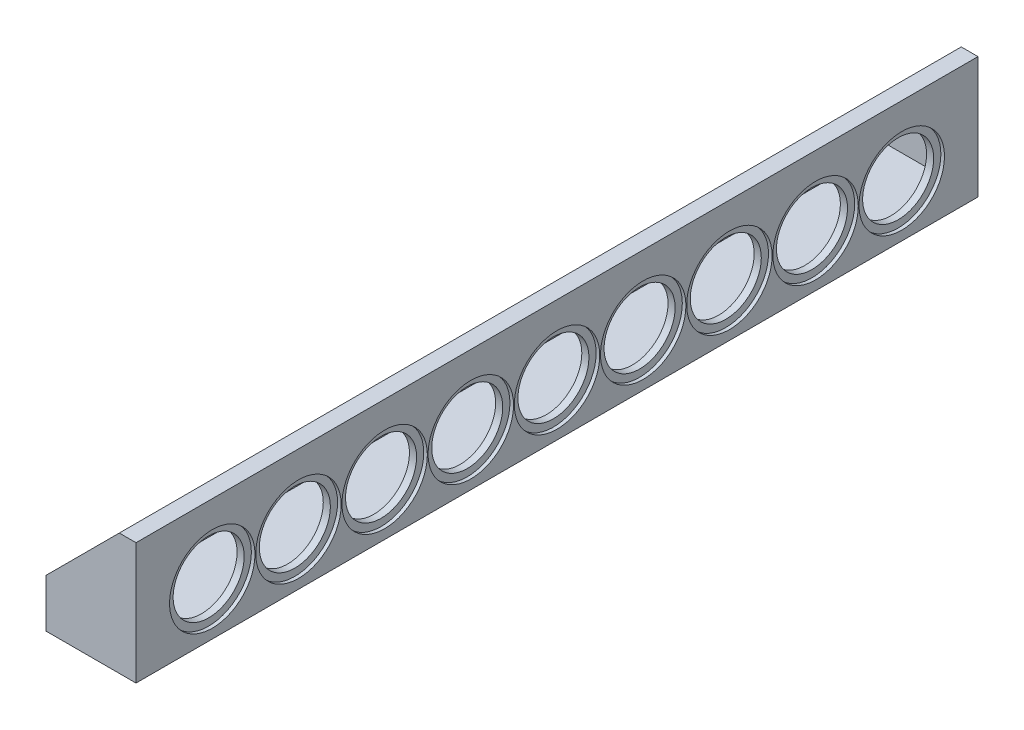
from build123d import *

# Parameters (mm, degrees)
BOSS_EXTRUDE1_DEPTH = 889
CHAMFER1_SIZE       = 51
CHAMFER1_SIZE2      = 72.124891681
CHAMFER2_SIZE       = 25
CHAMFER2_SIZE2      = 17.67766953
SKETCH4_R           = 45.1
CUT_EXTRUDE2_DEPTH  = 3.8
SKETCH5_R           = 37.5
CUT_EXTRUDE3_DEPTH  = 39.6
SHELL1_START        = -87.55
SHELL1_OUTLINE_W    = 113.37233047
SHELL1_OUTLINE_H    = 874
SHELL1_DEPTH        = 76.25
SHELL1_START_2      = -11.3
SHELL1_2_DEPTH      = 3.8
SHELL1_START_3      = -103.272945392
SHELL1_3_OUTLINE_W  = 103.207795667
SHELL1_3_OUTLINE_H  = 874
SHELL1_3_DEPTH      = 7.5


with BuildPart() as part:
    # Sketch1 → Boss-Extrude1 (new body)
    with BuildSketch(Plane.XY):
        Polygon((0, 146.05), (-146.05, 0), (0, 0), align=None)
    extrude(amount=BOSS_EXTRUDE1_DEPTH)

    # Chamfer1
    chamfer1_edges = [part.edges().sort_by_distance(p)[0] for p in [
        (-146.05, 0, 444.5),
    ]]
    chamfer1_side = [part.faces().sort_by_distance(p)[0] for p in [
        (-73.025, 0, 444.5),
    ]]
    chamfer(chamfer1_edges, length=CHAMFER1_SIZE, length2=CHAMFER1_SIZE2, reference=chamfer1_side[0])

    # Chamfer2
    chamfer2_edges = [part.edges().sort_by_distance(p)[0] for p in [
        (0, 146.05, 444.5),
    ]]
    chamfer2_side = [part.faces().sort_by_distance(p)[0] for p in [
        (-47.525, 98.525, 444.5),
    ]]
    chamfer(chamfer2_edges, length=CHAMFER2_SIZE, length2=CHAMFER2_SIZE2, reference=chamfer2_side[0])

    # Sketch4 → Cut-Extrude2 (cut)
    with BuildSketch(Plane(origin=(0, 0, 0), x_dir=(0, 0, -1), z_dir=(1, 0, 0))):
        with Locations((-444.5, 55)):
            Circle(SKETCH4_R)
        with Locations((-535.5, 55)):
            Circle(SKETCH4_R)
        with Locations((-626.5, 55)):
            Circle(SKETCH4_R)
        with Locations((-717.5, 55)):
            Circle(SKETCH4_R)
        with Locations((-808.5, 55)):
            Circle(SKETCH4_R)
        with Locations((-353.5, 55)):
            Circle(SKETCH4_R)
        with Locations((-262.5, 55)):
            Circle(SKETCH4_R)
        with Locations((-171.5, 55)):
            Circle(SKETCH4_R)
        with Locations((-80.5, 55)):
            Circle(SKETCH4_R)
    extrude(amount=-CUT_EXTRUDE2_DEPTH, mode=Mode.SUBTRACT)

    # Sketch5 → Cut-Extrude3 (cut)
    with BuildSketch(Plane(origin=(-3.8, 0, 0), x_dir=(0, 0, -1), z_dir=(1, 0, 0))):
        with Locations((-808.5, 55)):
            Circle(SKETCH5_R)
        with Locations((-717.5, 55)):
            Circle(SKETCH5_R)
        with Locations((-626.5, 55)):
            Circle(SKETCH5_R)
        with Locations((-535.5, 55)):
            Circle(SKETCH5_R)
        with Locations((-444.5, 55)):
            Circle(SKETCH5_R)
        with Locations((-353.5, 55)):
            Circle(SKETCH5_R)
        with Locations((-262.5, 55)):
            Circle(SKETCH5_R)
        with Locations((-171.5, 55)):
            Circle(SKETCH5_R)
        with Locations((-80.5, 55)):
            Circle(SKETCH5_R)
    extrude(amount=-CUT_EXTRUDE3_DEPTH, mode=Mode.SUBTRACT)

    # Shell1: read off the stored shape, not the designer's step
    # Shell1 outline → Shell1 (cut)
    with BuildSketch(Plane.YZ.offset(SHELL1_START)):
        with Locations((64.186165235, 444.5)):
            Rectangle(SHELL1_OUTLINE_W, SHELL1_OUTLINE_H)
    extrude(amount=SHELL1_DEPTH, mode=Mode.SUBTRACT)

    # Shell1 2 outline → Shell1 2 (cut)
    with BuildSketch(Plane.YZ.offset(SHELL1_START_2)):
        with BuildLine():
            Line((7.5, 57.90553165), (7.5, 7.5))
            Line((7.5, 7.5), (120.87233047, 7.5))
            Line((120.87233047, 7.5), (120.87233047, 881.5))
            Line((120.87233047, 881.5), (7.5, 881.5))
            Line((7.5, 881.5), (7.5, 831.09446835))
            ThreePointArc((7.5, 831.09446835), (90.645569183, 847.180142161), (81.391475897, 763))
            ThreePointArc((81.391475897, 763), (107.6, 717.5), (81.391475897, 672))
            ThreePointArc((81.391475897, 672), (107.6, 626.5), (81.391475897, 581))
            ThreePointArc((81.391475897, 581), (107.6, 535.5), (81.391475897, 490))
            ThreePointArc((81.391475897, 490), (107.6, 444.5), (81.391475897, 399))
            ThreePointArc((81.391475897, 399), (107.6, 353.5), (81.391475897, 308))
            ThreePointArc((81.391475897, 308), (107.6, 262.5), (81.391475897, 217))
            ThreePointArc((81.391475897, 217), (107.6, 171.5), (81.391475897, 126))
            ThreePointArc((81.391475897, 126), (90.645569183, 41.819857839), (7.5, 57.90553165))
        make_face()
        with BuildLine():
            Line((7.5, 148.90553165), (7.5, 103.09446835))
            ThreePointArc((7.5, 103.09446835), (16.319857839, 116.145569183), (28.608524103, 126))
            ThreePointArc((28.608524103, 126), (16.319857839, 135.854430817), (7.5, 148.90553165))
        make_face()
        with BuildLine():
            Line((7.5, 239.90553165), (7.5, 194.09446835))
            ThreePointArc((7.5, 194.09446835), (16.319857839, 207.145569183), (28.608524103, 217))
            ThreePointArc((28.608524103, 217), (16.319857839, 226.854430817), (7.5, 239.90553165))
        make_face()
        with BuildLine():
            ThreePointArc((28.608524103, 763), (16.319857839, 772.854430817), (7.5, 785.90553165))
            Line((7.5, 785.90553165), (7.5, 740.09446835))
            ThreePointArc((7.5, 740.09446835), (16.319857839, 753.145569183), (28.608524103, 763))
        make_face()
        with BuildLine():
            Line((7.5, 330.90553165), (7.5, 285.09446835))
            ThreePointArc((7.5, 285.09446835), (16.319857839, 298.145569183), (28.608524103, 308))
            ThreePointArc((28.608524103, 308), (16.319857839, 317.854430817), (7.5, 330.90553165))
        make_face()
        with BuildLine():
            ThreePointArc((28.608524103, 672), (16.319857839, 681.854430817), (7.5, 694.90553165))
            Line((7.5, 694.90553165), (7.5, 649.09446835))
            ThreePointArc((7.5, 649.09446835), (16.319857839, 662.145569183), (28.608524103, 672))
        make_face()
        with BuildLine():
            Line((7.5, 421.90553165), (7.5, 376.09446835))
            ThreePointArc((7.5, 376.09446835), (16.319857839, 389.145569183), (28.608524103, 399))
            ThreePointArc((28.608524103, 399), (16.319857839, 408.854430817), (7.5, 421.90553165))
        make_face()
        with BuildLine():
            ThreePointArc((28.608524103, 581), (16.319857839, 590.854430817), (7.5, 603.90553165))
            Line((7.5, 603.90553165), (7.5, 558.09446835))
            ThreePointArc((7.5, 558.09446835), (16.319857839, 571.145569183), (28.608524103, 581))
        make_face()
        with BuildLine():
            Line((7.5, 512.90553165), (7.5, 467.09446835))
            ThreePointArc((7.5, 467.09446835), (16.319857839, 480.145569183), (28.608524103, 490))
            ThreePointArc((28.608524103, 490), (16.319857839, 499.854430817), (7.5, 512.90553165))
        make_face()
    extrude(amount=SHELL1_2_DEPTH, mode=Mode.SUBTRACT)

    # Shell1 3 outline → Shell1 3 (add)
    with BuildSketch(Plane(origin=(0, 0, 0), x_dir=(0.7071067811865509, 0.707106781186544, 0), z_dir=(0.707106781186544, -0.707106781186551, 0)).offset(SHELL1_START_3)):
        with Locations((23.562445841, 444.5)):
            Rectangle(SHELL1_3_OUTLINE_W, SHELL1_3_OUTLINE_H)
    extrude(amount=SHELL1_3_DEPTH)


solid = part.part
